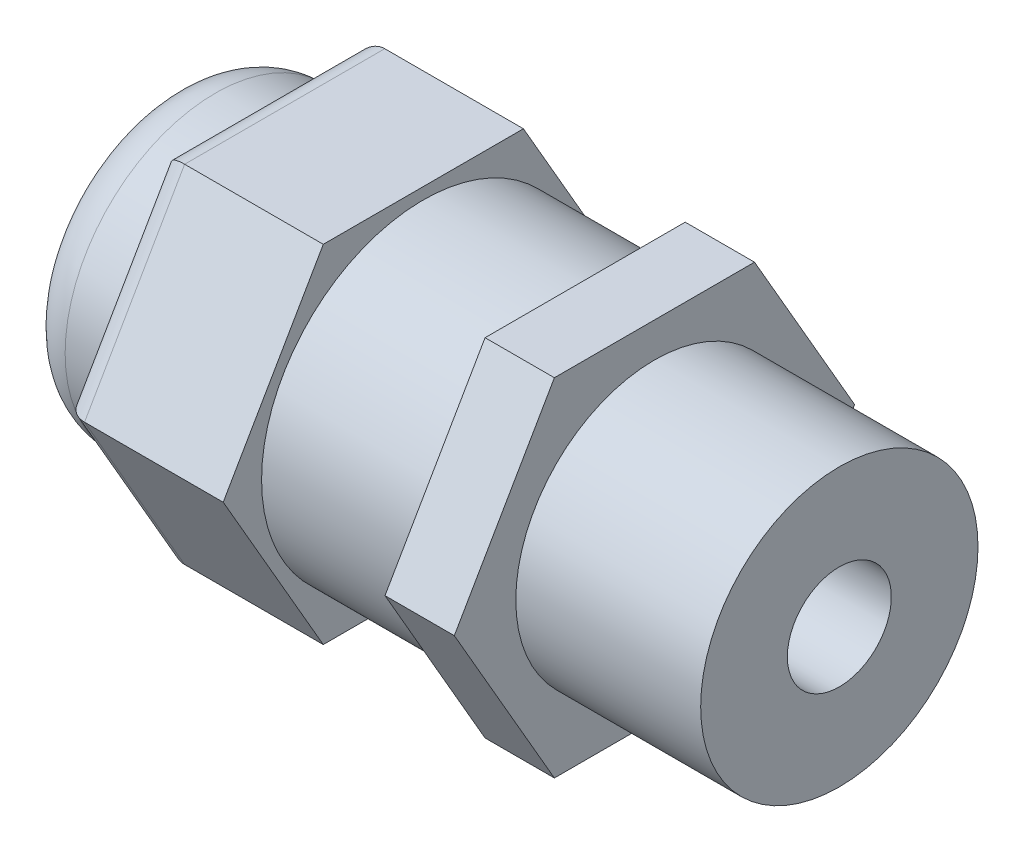
from build123d import *

# Parameters (mm, degrees)
BOSS_EXTRUDE1_DEPTH = 3
BOSS_EXTRUDE2_DEPTH = 7
SKETCH4_R           = 6.5
BOSS_EXTRUDE3_DEPTH = 4
FILLET1_R           = 2
FILLET2_R           = 1
SKETCH5_R           = 2.25
CUT_EXTRUDE1_DEPTH  = 32.180923655


with BuildPart() as part:
    # Sketch1 → Revolve1 (revolve)
    with BuildSketch(Plane.XY, mode=Mode.PRIVATE) as revolve1_sk:
        Polygon((11, 0), (11, 6), (0, 6), (0, 7), (-7, 7), (-7, 0), align=None)
    revolve(revolve1_sk.sketch.rotate(Axis((-13.395348837, 0, 0), (1, 0, 0)), 90), axis=Axis((-13.395348837, 0, 0), (1, 0, 0)))

    # Sketch2 → Boss-Extrude1 (add)
    with BuildSketch(Plane(origin=(0, 0, 0), x_dir=(0, 0, -1), z_dir=(1, 0, 0))):
        Polygon((4.330127019, -7.5), (8.660254038, 0), (4.330127019, 7.5), (-4.330127019, 7.5), (-8.660254038, 0), (-4.330127019, -7.5), align=None)
    extrude(amount=BOSS_EXTRUDE1_DEPTH)

    # Sketch3 → Boss-Extrude2 (add)
    with BuildSketch(Plane.ZY.offset(7)):
        Polygon((4.330127019, -7.5), (8.660254038, 0), (4.330127019, 7.5), (-4.330127019, 7.5), (-8.660254038, 0), (-4.330127019, -7.5), align=None)
    extrude(amount=BOSS_EXTRUDE2_DEPTH)

    # Sketch4 → Boss-Extrude3 (add)
    with BuildSketch(Plane.ZY.offset(14)):
        Circle(SKETCH4_R)
    extrude(amount=BOSS_EXTRUDE3_DEPTH)

    # Fillet1
    fillet1_edges = [part.edges().sort_by_distance(p)[0] for p in [
        (-18, 0, -6.5),
    ]]
    fillet(fillet1_edges, radius=FILLET1_R)

    # Fillet2
    fillet2_edges = [part.edges().sort_by_distance(p)[0] for p in [
        (-14, -7.5, 0),
        (-14, -3.75, 6.495190528),
        (-14, 3.75, 6.495190528),
        (-14, 7.5, 0),
        (-14, 3.75, -6.495190528),
        (-14, -3.75, -6.495190528),
    ]]
    fillet(fillet2_edges, radius=FILLET2_R - 0.0001)  # a hair under: the kernel refuses the full size

    # Sketch5 → Cut-Extrude1 (cut, through all)
    with BuildSketch(Plane.ZY.offset(18)):
        Circle(SKETCH5_R)
    extrude(amount=-CUT_EXTRUDE1_DEPTH, mode=Mode.SUBTRACT)


solid = part.part
